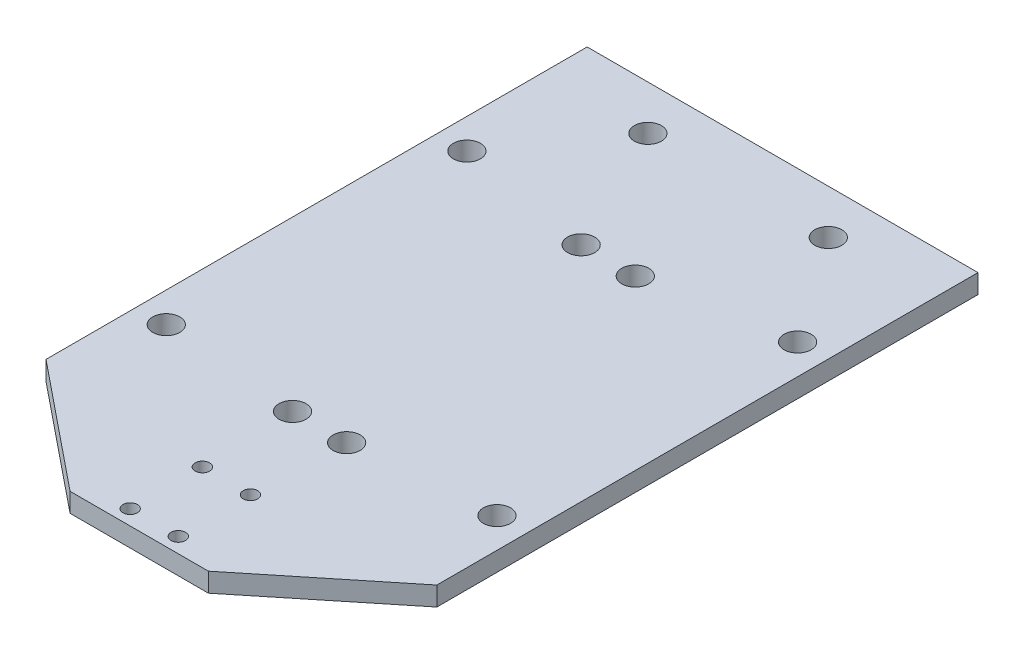
from build123d import *

# Parameters (mm, degrees)
BOSS_EXTRUDE1_DEPTH  = 1.5875
M2_CLEARANCE_HOLE1_D = 2.4
M4_CLEARANCE_HOLE1_D = 4.5
M4_CLEARANCE_HOLE2_D = 4.5
M4_CLEARANCE_HOLE3_D = 4.5


with BuildPart() as part:
    # Sketch1 → Boss-Extrude1 (new, symmetric)
    with BuildSketch(Plane(origin=(0, 0, 0), x_dir=(1, 0, 0), z_dir=(0, 1, 0))):
        Polygon((-32.5, -45), (-11.5, -62), (11.5, -62), (32.5, -45), (32.5, 45), (-32.5, 45), align=None)
    extrude(amount=BOSS_EXTRUDE1_DEPTH, both=True)

    # M2 Clearance Hole1 (through all)
    with Locations(Plane(origin=(0, 1.5875, 0), x_dir=(1, 0, 0), z_dir=(0, 1, 0))):
        with Locations((-4, -59.5), (4, -59.5), (4, -47.5), (-4, -47.5)):
            Hole(M2_CLEARANCE_HOLE1_D / 2)

    # M4 Clearance Hole1 (through all)
    with Locations(Plane(origin=(0, 1.5875, 0), x_dir=(1, 0, 0), z_dir=(0, 1, 0))):
        with Locations((-27.5, 20), (27.5, 20), (27.5, -30), (-27.5, -30)):
            Hole(M4_CLEARANCE_HOLE1_D / 2)

    # M4 Clearance Hole2 (through all)
    with Locations(Plane(origin=(0, 1.5875, 0), x_dir=(1, 0, 0), z_dir=(0, 1, 0))):
        with Locations((-4.5, -32), (4.5, -32), (4.5, 16), (-4.5, 16)):
            Hole(M4_CLEARANCE_HOLE2_D / 2)

    # M4 Clearance Hole3 (through all)
    with Locations(Plane(origin=(0, 1.5875, 0), x_dir=(1, 0, 0), z_dir=(0, 1, 0))):
        with Locations((15, 37.6), (-15, 37.6)):
            Hole(M4_CLEARANCE_HOLE3_D / 2)


solid = part.part
